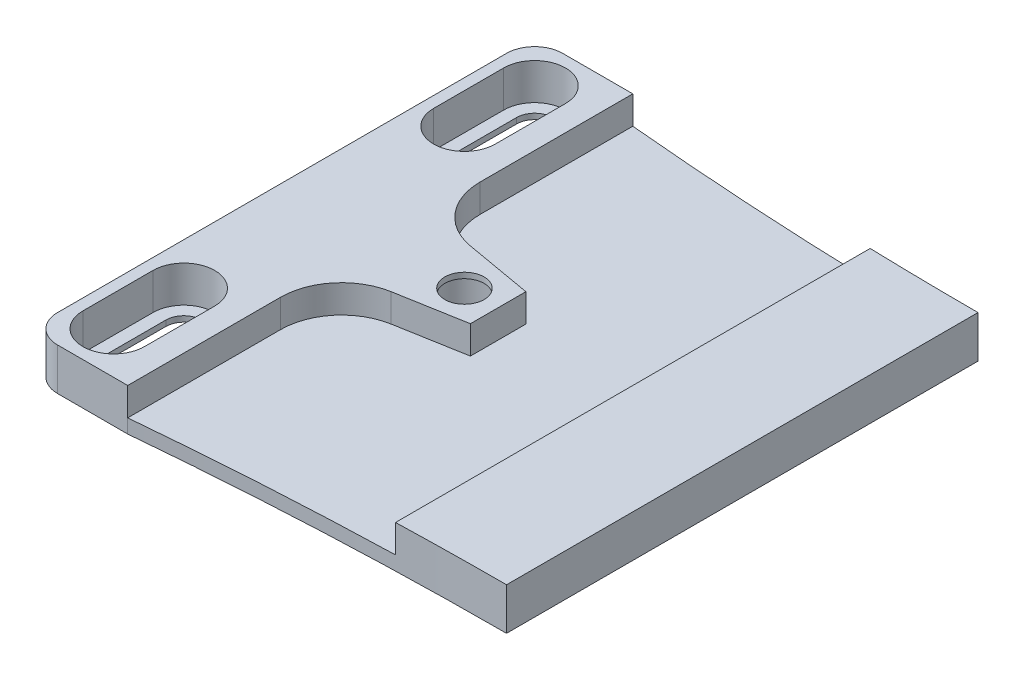
from build123d import *

# Parameters (mm, degrees)
SKETCH1_W                                           = 165
SKETCH1_H                                           = 90
BOSS_EXTRUDE1_DEPTH                                 = 7.5
CUT_EXTRUDE2_REACH                                  = 96.274
CBORE_START                                         = 1
CBORE_SLOT_FOR_M6_HEX_SOCKET_HEAD_CAP_SC_DEPTH      = 6.5
CBORE_SLOT_FOR_M6_HEX_SOCKET_HEAD_CA_3_DEPTH        = 1
FILLET1_R                                           = 5
CBORE_FOR_M6_HEX_SOCKET_HEAD_CAP_SCREW1_D           = 7
CBORE_FOR_M6_HEX_SOCKET_HEAD_CAP_SCREW1_CBORE_D     = 11
CBORE_FOR_M6_HEX_SOCKET_HEAD_CAP_SCREW1_CBORE_DEPTH = 6.5
CUT_EXTRUDE3_DEPTH                                  = 5
CUT_EXTRUDE4_REACH                                  = 96.274
SKETCH13_W                                          = 82.5
SKETCH13_H                                          = 90
CUT_EXTRUDE5_REACH                                  = 96.274
SKETCH14_W                                          = 0.5
SKETCH14_H                                          = 84.000354274


# Read off the part's stored shape, not the designer's step: CBORE SLOT for M6 Hex Socket Head Cap Screw1
with BuildPart() as part:
    # Sketch1 → Boss-Extrude1 (new body)
    with BuildSketch(Plane(origin=(0, 0, 0), x_dir=(1, 0, 0), z_dir=(0, 1, 0))):
        Rectangle(SKETCH1_W, SKETCH1_H)
    extrude(amount=BOSS_EXTRUDE1_DEPTH)

    # Sketch7 → Cut-Extrude2 (cut, up to next)
    with BuildSketch(Plane(origin=(0, 7.5, 0), x_dir=(1, 0, 0), z_dir=(0, 1, 0)), mode=Mode.PRIVATE) as cut_extrude2_sk1:
        with BuildLine():
            Line((-65, 45), (65, 45))
            ThreePointArc((65, 45), (0, 42), (-65, 45))
        make_face()
    cut_extrude2_tool1 = extrude(cut_extrude2_sk1.sketch, amount=-CUT_EXTRUDE2_REACH, mode=Mode.PRIVATE) & part.part
    # Sketch7 → Cut-Extrude2 (cut, up to next)
    with BuildSketch(Plane(origin=(0, 7.5, 0), x_dir=(1, 0, 0), z_dir=(0, 1, 0)), mode=Mode.PRIVATE) as cut_extrude2_sk2:
        with BuildLine():
            Line((-65, -45), (65, -45))
            ThreePointArc((65, -45), (0, -42), (-65, -45))
        make_face()
    cut_extrude2_tool2 = extrude(cut_extrude2_sk2.sketch, amount=-CUT_EXTRUDE2_REACH, mode=Mode.PRIVATE) & part.part
    add(cut_extrude2_tool1.solids().sort_by_distance((0, 7.5, -43.799781))[0], mode=Mode.SUBTRACT)
    add(cut_extrude2_tool2.solids().sort_by_distance((0, 7.5, 43.799781))[0], mode=Mode.SUBTRACT)

    # CBORE SLOT for M6 Hex Socket Head Ca 2 → CBORE SLOT for M6 Hex Socket Head Cap Screw1 (cut)
    with BuildSketch(Plane(origin=(0, 0, 0), x_dir=(1, 0, 0), z_dir=(0, 1, 0)).offset(CBORE_START)):
        with BuildLine():
            Line((80.5, -37.5), (80.5, -25))
            ThreePointArc((80.5, -25), (75, -19.5), (69.5, -25))
            Line((69.5, -25), (69.5, -37.5))
            ThreePointArc((69.5, -37.5), (75, -43), (80.5, -37.5))
        make_face()
        with BuildLine():
            ThreePointArc((80.5, 37.5), (75, 43), (69.5, 37.5))
            Line((69.5, 37.5), (69.5, 25))
            ThreePointArc((69.5, 25), (75, 19.5), (80.5, 25))
            Line((80.5, 25), (80.5, 37.5))
        make_face()
        with BuildLine():
            Line((-69.5, -37.5), (-69.5, -25))
            ThreePointArc((-69.5, -25), (-75, -19.5), (-80.5, -25))
            Line((-80.5, -25), (-80.5, -37.5))
            ThreePointArc((-80.5, -37.5), (-75, -43), (-69.5, -37.5))
        make_face()
        with BuildLine():
            ThreePointArc((-69.5, 37.5), (-75, 43), (-80.5, 37.5))
            Line((-80.5, 37.5), (-80.5, 25))
            ThreePointArc((-80.5, 25), (-75, 19.5), (-69.5, 25))
            Line((-69.5, 25), (-69.5, 37.5))
        make_face()
    extrude(amount=CBORE_SLOT_FOR_M6_HEX_SOCKET_HEAD_CAP_SC_DEPTH, mode=Mode.SUBTRACT)

    # CBORE SLOT for M6 Hex Socket Head Ca 3 o → CBORE SLOT for M6 Hex Socket Head Ca 3 (cut)
    with BuildSketch(Plane(origin=(0, 0, 0), x_dir=(1, 0, 0), z_dir=(0, 1, 0))):
        with BuildLine():
            Line((78.2, -37.5), (78.2, -25))
            ThreePointArc((78.2, -25), (75, -21.8), (71.8, -25))
            Line((71.8, -25), (71.8, -37.5))
            ThreePointArc((71.8, -37.5), (75, -40.7), (78.2, -37.5))
        make_face()
        with BuildLine():
            ThreePointArc((78.2, 37.5), (75, 40.7), (71.8, 37.5))
            Line((71.8, 37.5), (71.8, 25))
            ThreePointArc((71.8, 25), (75, 21.8), (78.2, 25))
            Line((78.2, 25), (78.2, 37.5))
        make_face()
        with BuildLine():
            Line((-71.8, -37.5), (-71.8, -25))
            ThreePointArc((-71.8, -25), (-75, -21.8), (-78.2, -25))
            Line((-78.2, -25), (-78.2, -37.5))
            ThreePointArc((-78.2, -37.5), (-75, -40.7), (-71.8, -37.5))
        make_face()
        with BuildLine():
            ThreePointArc((-71.8, 37.5), (-75, 40.7), (-78.2, 37.5))
            Line((-78.2, 37.5), (-78.2, 25))
            ThreePointArc((-78.2, 25), (-75, 21.8), (-71.8, 25))
            Line((-71.8, 25), (-71.8, 37.5))
        make_face()
    extrude(amount=CBORE_SLOT_FOR_M6_HEX_SOCKET_HEAD_CA_3_DEPTH, mode=Mode.SUBTRACT)

    # Fillet1
    fillet1_edges = [part.edges().sort_by_distance(p)[0] for p in [
        (82.5, 3.75, 45),
        (-82.5, 3.75, 45),
        (-82.5, 3.75, -45),
        (82.5, 3.75, -45),
    ]]
    fillet(fillet1_edges, radius=FILLET1_R)

    # CBORE for M6 Hex Socket Head Cap Screw1 (through all)
    with Locations(Plane.XZ):
        with Locations((-50, 0), (50, 0)):
            CounterBoreHole(CBORE_FOR_M6_HEX_SOCKET_HEAD_CAP_SCREW1_D / 2, CBORE_FOR_M6_HEX_SOCKET_HEAD_CAP_SCREW1_CBORE_D / 2, CBORE_FOR_M6_HEX_SOCKET_HEAD_CAP_SCREW1_CBORE_DEPTH)

    # Sketch12 → Cut-Extrude3 (cut)
    with BuildSketch(Plane(origin=(0, 7.5, 0), x_dir=(1, 0, 0), z_dir=(0, 1, 0))):
        with BuildLine():
            Line((-65, 45), (-65, 17.783744218))
            ThreePointArc((-65, 17.783744218), (-62.451932754, 10.782986997), (-56, 7.057961884))
            Line((-56, 7.057961884), (-44, 4.942038116))
            Line((-44, 4.942038116), (-44, -4.942038116))
            Line((-44, -4.942038116), (-56, -7.057961884))
            ThreePointArc((-56, -7.057961884), (-62.451932754, -10.782986997), (-65, -17.783744218))
            Line((-65, -17.783744218), (-65, -45))
            Line((-65, -45), (-20, -45))
            Line((-20, -45), (-20, 45))
            Line((-20, 45), (-65, 45))
        make_face()
        with BuildLine():
            Line((44, 4.942038116), (44, -4.942038116))
            Line((44, -4.942038116), (56, -7.057961884))
            ThreePointArc((56, -7.057961884), (62.451932754, -10.782986997), (65, -17.783744218))
            Line((65, -17.783744218), (65, -45))
            Line((65, -45), (20, -45))
            Line((20, -45), (20, 45))
            Line((20, 45), (65, 45))
            Line((65, 45), (65, 17.783744218))
            ThreePointArc((65, 17.783744218), (62.451932754, 10.782986997), (56, 7.057961884))
            Line((56, 7.057961884), (44, 4.942038116))
        make_face()
    extrude(amount=-CUT_EXTRUDE3_DEPTH, mode=Mode.SUBTRACT)

    # Sketch13 → Cut-Extrude4 (cut, up to next)
    with BuildSketch(Plane(origin=(0, 7.5, 0), x_dir=(1, 0, 0), z_dir=(0, 1, 0)), mode=Mode.PRIVATE) as cut_extrude4_sk1:
        with Locations((41.25, 0)):
            Rectangle(SKETCH13_W, SKETCH13_H)
    cut_extrude4_tool1 = extrude(cut_extrude4_sk1.sketch, amount=-CUT_EXTRUDE4_REACH, mode=Mode.PRIVATE) & part.part
    add(cut_extrude4_tool1.solids().sort_by_distance((41.25, 7.5, 0))[0], mode=Mode.SUBTRACT)

    # Sketch14 → Cut-Extrude5 (cut, up to next)
    with BuildSketch(Plane(origin=(0, 7.5, 0), x_dir=(1, 0, 0), z_dir=(0, 1, 0)), mode=Mode.PRIVATE) as cut_extrude5_sk1:
        with Locations((-0.25, 0)):
            Rectangle(SKETCH14_W, SKETCH14_H)
    cut_extrude5_tool1 = extrude(cut_extrude5_sk1.sketch, amount=-CUT_EXTRUDE5_REACH, mode=Mode.PRIVATE) & part.part
    add(cut_extrude5_tool1.solids().sort_by_distance((-0.25, 7.5, 0))[0], mode=Mode.SUBTRACT)


solid = part.part
